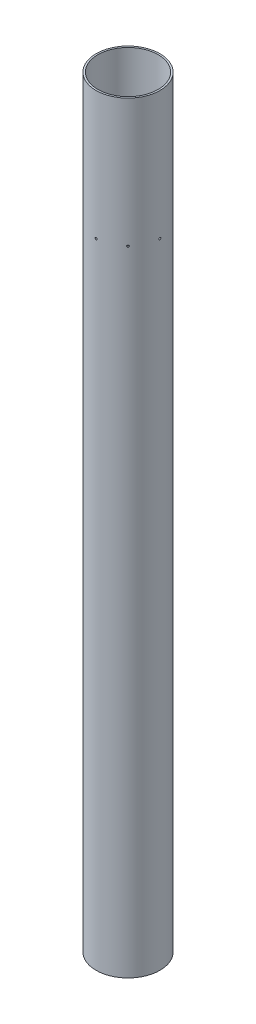
from build123d import *

# Parameters (mm, degrees)
SKETCH1_R           = 53.721
SKETCH1_R_2         = 50.8
BOSS_EXTRUDE1_DEPTH = 1282.7
CUT_EXTRUDE1_REACH  = 1290.312
SKETCH2_R           = 1.6383
CIRPATTERN1_COUNT   = 8


with BuildPart() as part:
    # Sketch1 → Boss-Extrude1 (new body)
    with BuildSketch(Plane(origin=(0, 0, 0), x_dir=(1, 0, 0), z_dir=(0, 1, 0))):
        Circle(SKETCH1_R)
        Circle(SKETCH1_R_2, mode=Mode.SUBTRACT)
    extrude(amount=BOSS_EXTRUDE1_DEPTH)

    # Sketch2 → Cut-Extrude1 (cut, up to next)
    with BuildSketch(Plane.XY.offset(53.721), mode=Mode.PRIVATE) as cut_extrude1_sk1:
        with Locations((0, 1066.8)):
            Circle(SKETCH2_R)
    cut_extrude1_tool1 = extrude(cut_extrude1_sk1.sketch, amount=-CUT_EXTRUDE1_REACH, mode=Mode.PRIVATE) & part.part
    cut_extrude1 = cut_extrude1_tool1.solids().sort_by_distance((0, 1066.8, 53.721))[0]
    add(cut_extrude1, mode=Mode.SUBTRACT)

    # CirPattern1: Cut-Extrude1 ×8 about axis
    cirpattern1_axis = Axis((0, 1282.7, 0), (0, -1, 0))
    for i in range(1, CIRPATTERN1_COUNT):
        add(cut_extrude1.rotate(cirpattern1_axis, i * 360 / CIRPATTERN1_COUNT), mode=Mode.SUBTRACT)


solid = part.part
